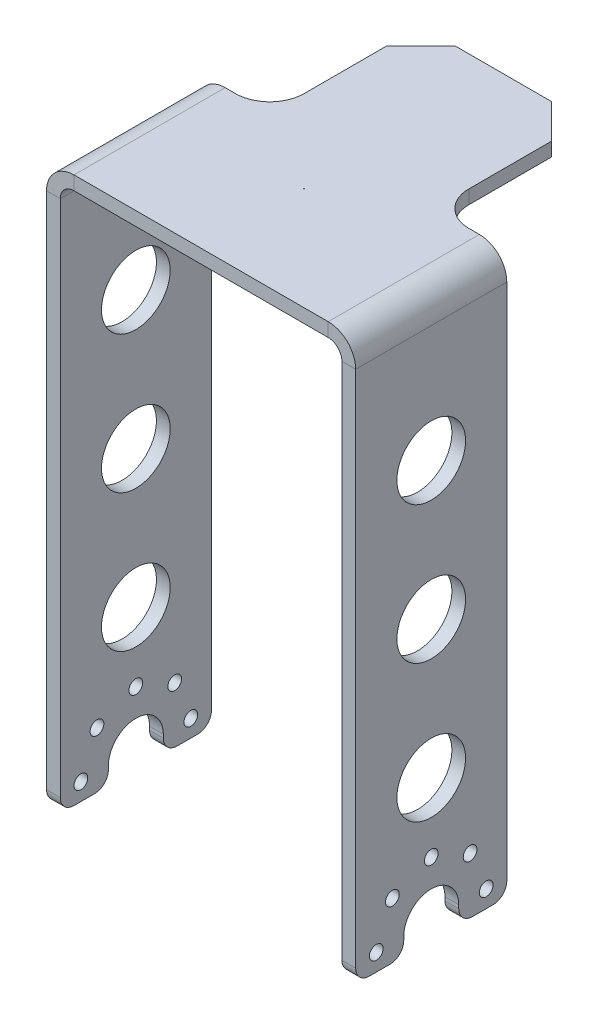
from build123d import *

# Parameters (mm, degrees)
BASE_FLANGE1_DEPTH = 22
CUT_EXTRUDE1_DEPTH = 96.665963068
FILLET1_R          = 2
SKETCH4_R          = 1
CUT_EXTRUDE2_DEPTH = 96.665963068
SKETCH5_W          = 24
SKETCH5_H          = 22
TAB1_DEPTH         = 2
SKETCH6_R          = 0.05
CUT_EXTRUDE3_DEPTH = 10
FILLET2_R          = 5
CHAMFER1_SIZE      = 5
SKETCH7_R          = 5
CUT_EXTRUDE4_DEPTH = 96.665963068


# Sheet-metal steps are written as plain solids
with BuildPart() as part:
    # Sketch1 → Base-Flange1 (new body)
    with BuildSketch(Plane.XY):
        with BuildLine():
            Line((-20.5, 0), (-20.5, 77.50445687))
            ThreePointArc((-20.5, 77.50445687), (-19.914213562, 78.918670432), (-18.5, 79.50445687))
            Line((-18.5, 79.50445687), (18.5, 79.50445687))
            ThreePointArc((18.5, 79.50445687), (19.914213562, 78.918670432), (20.5, 77.50445687))
            Line((20.5, 77.50445687), (20.5, 0))
            Line((20.5, 0), (22.5, 0))
            Line((22.5, 0), (22.5, 77.50445687))
            ThreePointArc((22.5, 77.50445687), (21.328427125, 80.332883995), (18.5, 81.50445687))
            Line((18.5, 81.50445687), (-18.5, 81.50445687))
            ThreePointArc((-18.5, 81.50445687), (-21.328427125, 80.332883995), (-22.5, 77.50445687))
            Line((-22.5, 77.50445687), (-22.5, 0))
            Line((-22.5, 0), (-20.5, 0))
        make_face()
    extrude(amount=BASE_FLANGE1_DEPTH)

    # Sketch3 → Cut-Extrude1 (cut, through all)
    with BuildSketch(Plane.ZY.offset(22.5)):
        with BuildLine():
            Line((7, 0), (15, 0))
            Line((15, 0), (15, 2.5))
            ThreePointArc((15, 2.5), (11, 6.5), (7, 2.5))
            Line((7, 2.5), (7, 0))
        make_face()
    extrude(amount=-CUT_EXTRUDE1_DEPTH, mode=Mode.SUBTRACT)

    # Fillet1
    fillet1_edges = [part.edges().sort_by_distance(p)[0] for p in [
        (21.5, 0, 0),
        (-21.5, 0, 0),
        (21.5, 0, 22),
        (-21.5, 0, 7),
        (-21.5, 0, 15),
        (21.5, 0, 7),
        (21.5, 0, 15),
        (-21.5, 0, 22),
    ]]
    fillet(fillet1_edges, radius=FILLET1_R)

    # Sketch4 → Cut-Extrude2 (cut, through all)
    with BuildSketch(Plane.ZY.offset(22.5)):
        with Locations((19, 2.5)):
            Circle(SKETCH4_R)
        with Locations((16.656854249, 8.156854249)):
            Circle(SKETCH4_R)
        with Locations((11, 10.5)):
            Circle(SKETCH4_R)
        with Locations((5.343145751, 8.156854249)):
            Circle(SKETCH4_R)
        with Locations((3, 2.5)):
            Circle(SKETCH4_R)
    extrude(amount=-CUT_EXTRUDE2_DEPTH, mode=Mode.SUBTRACT)

    # Sketch5 → Tab1 (add)
    with BuildSketch(Plane(origin=(0, 81.50445687, 0), x_dir=(1, 0, 0), z_dir=(0, 1, 0))):
        with Locations((0, 11)):
            Rectangle(SKETCH5_W, SKETCH5_H)
    extrude(amount=-TAB1_DEPTH)

    # Sketch6 → Cut-Extrude3 (cut)
    with BuildSketch(Plane(origin=(0, 81.50445687, 0), x_dir=(1, 0, 0), z_dir=(0, 1, 0))):
        with Locations(Location((0, -7, 0), (0, 0, 270))):
            Circle(SKETCH6_R)
    extrude(amount=-CUT_EXTRUDE3_DEPTH, mode=Mode.SUBTRACT)

    # Fillet2
    fillet2_edges = [part.edges().sort_by_distance(p)[0] for p in [
        (-12, 80.50445687, 0),
        (12, 80.50445687, 0),
    ]]
    fillet(fillet2_edges, radius=FILLET2_R)

    # Chamfer1
    chamfer1_edges = [part.edges().sort_by_distance(p)[0] for p in [
        (-12, 80.50445687, -22),
        (12, 80.50445687, -22),
    ]]
    chamfer(chamfer1_edges, length=CHAMFER1_SIZE)

    # Sketch7 → Cut-Extrude4 (cut, through all)
    with BuildSketch(Plane.ZY.offset(22.5)):
        with Locations((11, 40.5)):
            Circle(SKETCH7_R)
        with Locations((11, 60.5)):
            Circle(SKETCH7_R)
        with Locations((11, 20.5)):
            Circle(SKETCH7_R)
    extrude(amount=-CUT_EXTRUDE4_DEPTH, mode=Mode.SUBTRACT)


solid = part.part
